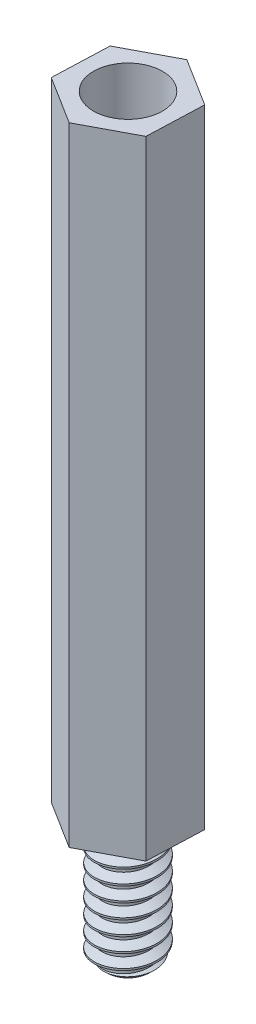
from build123d import *
from build123d.topology import SkipClean

# Parameters (mm, degrees)
BOSS_EXTRUDE1_DEPTH   = 30
M4_TAPPED_HOLE1_D     = 3.3
M4_TAPPED_HOLE1_DEPTH = 6
M4_TAPPED_HOLE1_TIP   = 0.991420021
SKETCH4_R             = 1.5
BOSS_EXTRUDE2_DEPTH   = 6
FILLET1_SIZE          = 0.5
THREAD1_PITCH         = 0.7


with BuildPart() as part:
    # Sketch1 → Boss-Extrude1 (new body)
    with BuildSketch(Plane(origin=(0, 0, 0), x_dir=(1, 0, 0), z_dir=(0, 1, 0))):
        Polygon((2.298297329, -1.442623554), (2.398497311, 1.269072095), (0.100199982, 2.71169565), (-2.298297329, 1.442623554), (-2.398497311, -1.269072095), (-0.100199982, -2.71169565), align=None)
    extrude(amount=BOSS_EXTRUDE1_DEPTH)

    # M4 Tapped Hole1
    with Locations(Plane(origin=(0, 30, 0), x_dir=(1, 0, 0), z_dir=(0, 1, 0))):
        with Locations((0, 0)):
            Hole(M4_TAPPED_HOLE1_D / 2, depth=M4_TAPPED_HOLE1_DEPTH)
            with Locations((0, 0, -(M4_TAPPED_HOLE1_DEPTH + M4_TAPPED_HOLE1_TIP / 2))):  # 118° drill point
                Cone(0, M4_TAPPED_HOLE1_D / 2, M4_TAPPED_HOLE1_TIP, mode=Mode.SUBTRACT)

    # Sketch4 → Boss-Extrude2 (add)
    with BuildSketch(Plane.XZ):
        with Locations(Location((0, 0, 0), (0, 0, 270))):
            Circle(SKETCH4_R)
    extrude(amount=BOSS_EXTRUDE2_DEPTH)

    # Fillet1
    # a fillet whose section is not a circle: 0.5 mm, written as the material it takes off along each edge
    with BuildSketch(Plane(origin=(0, -6, 0), x_dir=(0, 0, -1), z_dir=(-1, 0, 0))) as fillet1_piece_1:
        with BuildLine():
            Bezier((1.5, -FILLET1_SIZE), (1.5, 0), (1.5 - FILLET1_SIZE, 0), weights=[1, 0.035355339, 1])
            Line((1.5 - FILLET1_SIZE, 0), (1.5, 0))
            Line((1.5, 0), (1.5, -FILLET1_SIZE))
        make_face()
    revolve(axis=Axis((0, -6, 0), (0, -1, 0)), mode=Mode.SUBTRACT)

    # Thread1: arcs per turn and ends read off the stored shape
    # Thread1: the profile of Thread Profile1 profile screwed along a right-hand helix through 8.571429 turns, 6 arcs to a turn; built about Z, then put on its axis
    with SkipClean():  # the faces are left unmerged after this step: merging them gives an invalid solid
        thread1_z = Axis((0, 0, 0), (0, 0, 1))
        thread1_corners = [(1.5003, 0, -0.000173205), (1.5003, 0, 0.612673203), (1.121113888, 0, 0.393749999), (1.121113888, 0, 0.218749999)]
        with BuildLine(mode=Mode.PRIVATE) as thread1_profile:
            Line(thread1_corners[0], thread1_corners[1])
            Line(thread1_corners[1], thread1_corners[2])
            Line(thread1_corners[2], thread1_corners[3])
            Line(thread1_corners[3], thread1_corners[0])
        thread1_cap = Face(thread1_profile.wire())
        thread1_turn_angles = [0, 30, 60, 90, 120, 150, 180, 210, 240, 270, 300, 330, 360]
        thread1_turn_weights = [1, 0.8660254037844387, 1, 0.8660254037844387, 1, 0.8660254037844387, 1, 0.8660254037844387, 1, 0.8660254037844387, 1, 0.8660254037844387, 1]
        thread1_turn_rails = [Edge.make_bspline([Vector(p[0], p[1], 0).rotate(thread1_z, thread1_turn_angles[k]) / thread1_turn_weights[k] + Vector(0, 0, p[2] + THREAD1_PITCH * thread1_turn_angles[k] / 360) for k in range(13)], [0, 0, 0, 1, 1, 2, 2, 3, 3, 4, 4, 5, 5, 6, 6, 6], 2, thread1_turn_weights) for p in thread1_corners]
        thread1_turn_sides = [Face.make_surface_from_curves(thread1_turn_rails[p[0]], thread1_turn_rails[p[1]]) for p in [(0, 1), (1, 2), (2, 3), (3, 0)]]
        thread1_last_angles = [2880, 2910, 2940, 2970, 3000, 3030, 3060, 3072.857142857, 3085.714285714]
        thread1_last_weights = [1, 0.8660254037844387, 1, 0.8660254037844387, 1, 0.8660254037844387, 1, 0.9749279121818235, 1]
        thread1_last_rails = [Edge.make_bspline([Vector(p[0], p[1], 0).rotate(thread1_z, thread1_last_angles[k]) / thread1_last_weights[k] + Vector(0, 0, p[2] + THREAD1_PITCH * thread1_last_angles[k] / 360) for k in range(9)], [0, 0, 0, 1, 1, 2, 2, 3, 3, 4, 4, 4], 2, thread1_last_weights) for p in thread1_corners]
        thread1_last_sides = [Face.make_surface_from_curves(thread1_last_rails[p[0]], thread1_last_rails[p[1]]) for p in [(0, 1), (1, 2), (2, 3), (3, 0)]]
        thread1 = Plane(origin=(0, 0, 0), x_dir=(-1, 0, 0), z_dir=(0, -1, 0)) * Solid(Shell([*[p.moved(Location((0, 0, THREAD1_PITCH * i))) for i in range(8) for p in thread1_turn_sides], *thread1_last_sides, thread1_cap, thread1_cap.rotate(thread1_z, 3085.714285714).moved(Location((0, 0, THREAD1_PITCH * 3085.714285714 / 360)))]))
        add(thread1, mode=Mode.SUBTRACT)


solid = part.part
